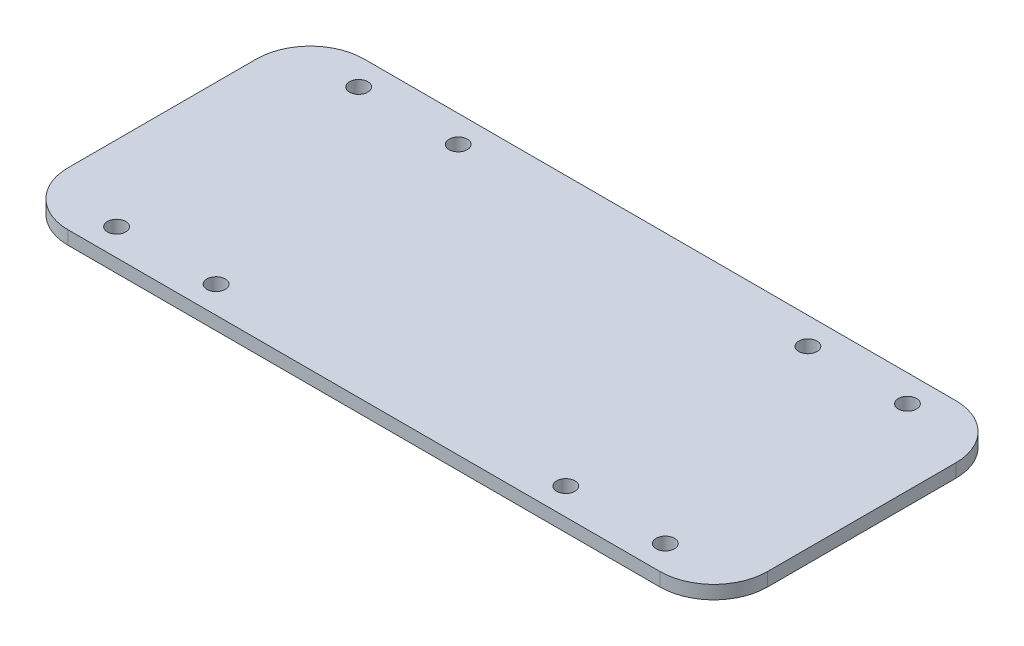
from build123d import *

# Parameters (mm, degrees)
BOSS_EXTRUDE1_DEPTH = 2.5
SKETCH2_R           = 1.7
CUT_EXTRUDE1_DEPTH  = 142.178079035
SKETCH3_R           = 1.7
CUT_EXTRUDE2_DEPTH  = 10


with BuildPart() as part:
    # Sketch1 → Boss-Extrude1 (new body)
    with BuildSketch(Plane(origin=(0, 0, 0), x_dir=(1, 0, 0), z_dir=(0, 1, 0))):
        with BuildLine():
            Line((10, 0), (120, 0))
            ThreePointArc((120, 0), (127.071067812, 2.928932188), (130, 10))
            Line((130, 10), (130, 45))
            ThreePointArc((130, 45), (127.071067812, 52.071067812), (120, 55))
            Line((120, 55), (10, 55))
            ThreePointArc((10, 55), (2.928932188, 52.071067812), (0, 45))
            Line((0, 45), (0, 10))
            ThreePointArc((0, 10), (2.928932188, 2.928932188), (10, 0))
        make_face()
    extrude(amount=BOSS_EXTRUDE1_DEPTH)

    # Sketch2 → Cut-Extrude1 (cut, through all)
    with BuildSketch(Plane(origin=(0, 2.5, 0), x_dir=(1, 0, 0), z_dir=(0, 1, 0))):
        with Locations((14, 5)):
            Circle(SKETCH2_R)
        with Locations((14, 50)):
            Circle(SKETCH2_R)
        with Locations((116, 5)):
            Circle(SKETCH2_R)
        with Locations((116, 50)):
            Circle(SKETCH2_R)
    extrude(amount=-CUT_EXTRUDE1_DEPTH, mode=Mode.SUBTRACT)

    # Sketch3 → Cut-Extrude2 (cut)
    with BuildSketch(Plane(origin=(0, 2.5, 0), x_dir=(1, 0, 0), z_dir=(0, 1, 0))):
        with Locations((32.5, 50)):
            Circle(SKETCH3_R)
        with Locations((32.5, 5)):
            Circle(SKETCH3_R)
        with Locations((97.5, 5)):
            Circle(SKETCH3_R)
        with Locations((97.5, 50)):
            Circle(SKETCH3_R)
    extrude(amount=-CUT_EXTRUDE2_DEPTH, mode=Mode.SUBTRACT)


solid = part.part
